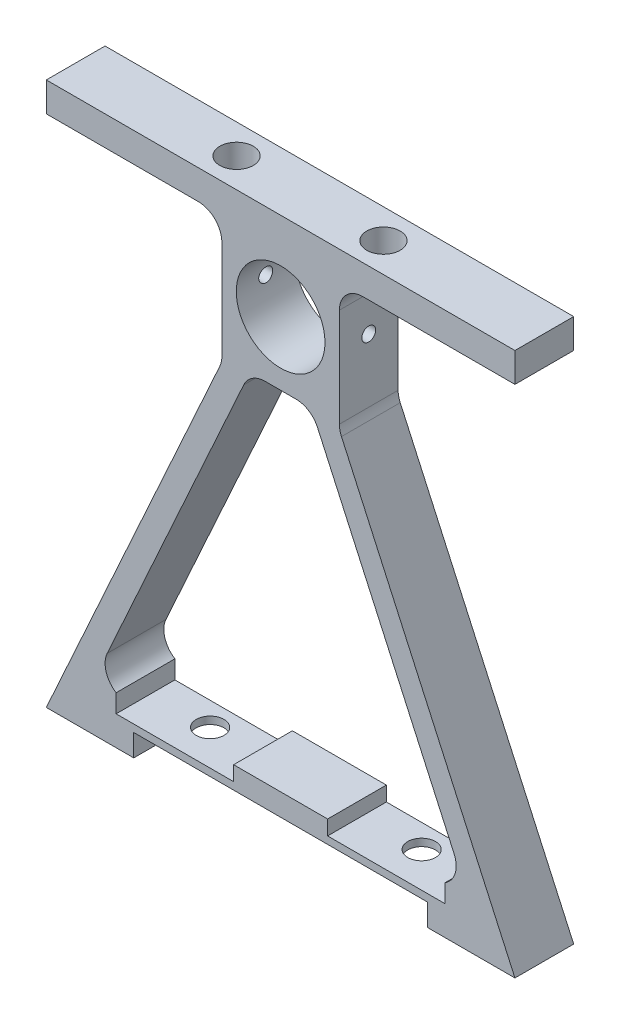
from build123d import *

# Parameters (mm, degrees)
SKETCH3_R               = 9.5885
BOSS_EXTRUDE1_DEPTH     = 12.7
SKETCH4_R               = 3.614257139
CUT_EXTRUDE1_DEPTH      = 6.35
CUT_EXTRUDE2_START      = -12.7
CUT_EXTRUDE2_OUTLINE_R  = 1.5
CUT_EXTRUDE2_DEPTH      = 25.4
CUT_EXTRUDE3_DEPTH      = 126.664030474
CUT_EXTRUDE3_DEPTH_BACK = 126.664030474
SKETCH8_W               = 25.4
SKETCH8_H               = 5.08
SKETCH9_R               = 3
CUT_EXTRUDE4_DEPTH      = 123.783240632


# Read off the part's stored shape, not the designer's step: Cut-Extrude2
with BuildPart() as part:
    # Sketch3 → Boss-Extrude1 (new body)
    with BuildSketch(Plane.XY):
        with BuildLine():
            Line((50.652428891, 3.175), (-50.652428891, 3.175))
            Line((-50.652428891, 3.175), (-50.652428891, -3.175))
            Line((-50.652428891, -3.175), (-17.78, -3.175))
            ThreePointArc((-17.78, -3.175), (-14.187897552, -4.662897552), (-12.7, -8.255))
            Line((-12.7, -8.255), (-12.7, -29.595434395))
            ThreePointArc((-12.7, -29.595434395), (-12.814872576, -30.66963627), (-13.154295145, -31.69525691))
            Line((-13.154295145, -31.69525691), (-50.652428891, -114.3))
            Line((-50.652428891, -114.3), (-31.75, -114.3))
            Line((-31.75, -114.3), (-31.75, -109.5375))
            Line((-31.75, -109.5375), (31.75, -109.5375))
            Line((31.75, -109.5375), (31.75, -114.3))
            Line((31.75, -114.3), (50.652428891, -114.3))
            Line((50.652428891, -114.3), (13.154295145, -31.69525691))
            ThreePointArc((13.154295145, -31.69525691), (12.814872576, -30.66963627), (12.7, -29.595434395))
            Line((12.7, -29.595434395), (12.7, -8.255))
            ThreePointArc((12.7, -8.255), (14.187897552, -4.662897552), (17.78, -3.175))
            Line((17.78, -3.175), (50.652428891, -3.175))
            Line((50.652428891, -3.175), (50.652428891, 3.175))
        make_face()
        with Locations((0, -15.875)):
            Circle(SKETCH3_R, mode=Mode.SUBTRACT)
        with BuildLine():
            Line((-7.97501727, -32.575611881), (-37.490421301, -97.595177486))
            ThreePointArc((-37.490421301, -97.595177486), (-37.135167146, -102.446299841), (-32.864716446, -104.775))
            Line((-32.864716446, -104.775), (0, -104.775))
            Line((0, -104.775), (32.864716446, -104.775))
            ThreePointArc((32.864716446, -104.775), (37.135167146, -102.446299841), (37.490421301, -97.595177486))
            Line((37.490421301, -97.595177486), (7.97501727, -32.575611881))
            ThreePointArc((7.97501727, -32.575611881), (6.100612256, -30.404983695), (3.349312415, -29.595434395))
            Line((3.349312415, -29.595434395), (-3.349312415, -29.595434395))
            ThreePointArc((-3.349312415, -29.595434395), (-6.100612256, -30.404983695), (-7.97501727, -32.575611881))
        make_face(mode=Mode.SUBTRACT)
    extrude(amount=BOSS_EXTRUDE1_DEPTH)

    # Sketch4 → Cut-Extrude1 (cut)
    with BuildSketch(Plane(origin=(0, 3.175, 0), x_dir=(1, 0, 0), z_dir=(0, 1, 0))):
        with Locations(Location((-15.875, -6.35, 0), (0, 0, 180))):
            Circle(SKETCH4_R)
        with Locations(Location((15.875, -6.35, 0), (0, 0, 301.808324175))):
            Circle(SKETCH4_R)
    extrude(amount=-CUT_EXTRUDE1_DEPTH, mode=Mode.SUBTRACT)

    # Cut-Extrude2 outline → Cut-Extrude2 (cut)
    with BuildSketch(Plane.YZ.offset(CUT_EXTRUDE2_START)):
        with Locations((-15.883331584, 6.35)):
            Circle(CUT_EXTRUDE2_OUTLINE_R)
    extrude(amount=CUT_EXTRUDE2_DEPTH, mode=Mode.SUBTRACT)

    # Sketch8 → Cut-Extrude3 (cut, two sides: drawn at the far end of the back side and taken through both)
    with BuildSketch(Plane.XY.offset(12.7).offset(-CUT_EXTRUDE3_DEPTH_BACK)):
        with Locations((-22.86, -105.41)):
            Rectangle(SKETCH8_W, SKETCH8_H)
        with Locations((22.86, -105.41)):
            Rectangle(SKETCH8_W, SKETCH8_H)
    extrude(amount=CUT_EXTRUDE3_DEPTH + CUT_EXTRUDE3_DEPTH_BACK, mode=Mode.SUBTRACT)

    # Sketch9 → Cut-Extrude4 (cut, through all)
    with BuildSketch(Plane(origin=(0, -107.95, 0), x_dir=(1, 0, 0), z_dir=(0, 1, 0))):
        with Locations(Location((-22.86, -5.08, 0), (0, 0, 270))):
            Circle(SKETCH9_R)
        with Locations((22.86, -5.08)):
            Circle(SKETCH9_R)
    extrude(amount=-CUT_EXTRUDE4_DEPTH, mode=Mode.SUBTRACT)


solid = part.part
